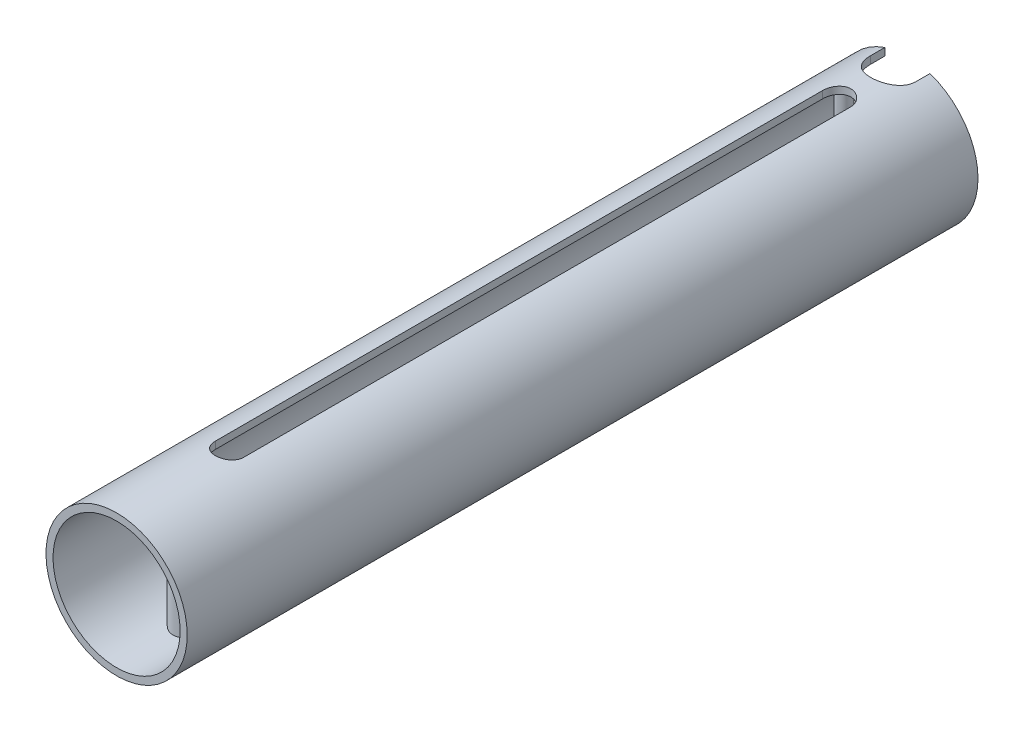
from build123d import *

# Parameters (mm, degrees)
ESQUISSE1_R                    = 5
ESQUISSE1_R_2                  = 4.5
BOSS_EXTRU_1_DEPTH             = 28
BOSS_EXTRU_2_REACH             = 30.879
ESQUISSE2_R                    = 1
ESQUISSE2_R_2                  = 0.5
BOSS_EXTRU_2_DIRECTION_2_REACH = 30.879
ENL_V_MAT_EXTRU_1_DEPTH        = 29.879058253
ENL_V_MAT_EXTRU_1_DEPTH_BACK   = 29.879058253
ENL_V_MAT_EXTRU_2_DEPTH        = 29.879058291
ENL_V_MAT_EXTRU_2_DEPTH_BACK   = 29.879058291


with BuildPart() as part:
    # Esquisse1 → Boss.-Extru.1 (new, symmetric)
    with BuildSketch(Plane.XY):
        Circle(ESQUISSE1_R)
        Circle(ESQUISSE1_R_2, mode=Mode.SUBTRACT)
    extrude(amount=BOSS_EXTRU_1_DEPTH, both=True)

    # Esquisse2 → Boss.-Extru.2 (add, up to next)
    with BuildSketch(Plane(origin=(0, 0, 0), x_dir=(1, 0, 0), z_dir=(0, 1, 0)), mode=Mode.PRIVATE) as boss_extru_2_sk1:
        with Locations((0, -23)):
            Circle(ESQUISSE2_R)
    boss_extru_2_tool1 = extrude(boss_extru_2_sk1.sketch, amount=BOSS_EXTRU_2_REACH, mode=Mode.PRIVATE) - part.part
    # Esquisse2 → Boss.-Extru.2 (add, up to next)
    with BuildSketch(Plane(origin=(0, 0, 0), x_dir=(1, 0, 0), z_dir=(0, 1, 0)), mode=Mode.PRIVATE) as boss_extru_2_sk2:
        with Locations((-3, 26.5)):
            Circle(ESQUISSE2_R_2)
    boss_extru_2_tool2 = extrude(boss_extru_2_sk2.sketch, amount=BOSS_EXTRU_2_REACH, mode=Mode.PRIVATE) - part.part
    add(boss_extru_2_tool1.solids().sort_by_distance((0, 0, 23))[0])
    add(boss_extru_2_tool2.solids().sort_by_distance((-3, 0, -26.5))[0])

    # Esquisse2 → Boss.-Extru.2 direction 2 (add, up to next)
    with BuildSketch(Plane(origin=(0, 0, 0), x_dir=(1, 0, 0), z_dir=(0, 1, 0)), mode=Mode.PRIVATE) as boss_extru_2_direction_2_sk1:
        with Locations((0, -23)):
            Circle(ESQUISSE2_R)
    boss_extru_2_direction_2_tool1 = extrude(boss_extru_2_direction_2_sk1.sketch, amount=-BOSS_EXTRU_2_DIRECTION_2_REACH, mode=Mode.PRIVATE) - part.part
    # Esquisse2 → Boss.-Extru.2 direction 2 (add, up to next)
    with BuildSketch(Plane(origin=(0, 0, 0), x_dir=(1, 0, 0), z_dir=(0, 1, 0)), mode=Mode.PRIVATE) as boss_extru_2_direction_2_sk2:
        with Locations((-3, 26.5)):
            Circle(ESQUISSE2_R_2)
    boss_extru_2_direction_2_tool2 = extrude(boss_extru_2_direction_2_sk2.sketch, amount=-BOSS_EXTRU_2_DIRECTION_2_REACH, mode=Mode.PRIVATE) - part.part
    add(boss_extru_2_direction_2_tool1.solids().sort_by_distance((0, 0, 23))[0])
    add(boss_extru_2_direction_2_tool2.solids().sort_by_distance((-3, 0, -26.5))[0])

    # Esquisse3 → Enlèv. mat.-Extru.1 (cut, two sides: drawn at the far end of the back side and taken through both)
    with BuildSketch(Plane(origin=(0, 0, 0), x_dir=(1, 0, 0), z_dir=(0, 1, 0)).offset(-ENL_V_MAT_EXTRU_1_DEPTH_BACK)):
        with BuildLine():
            Line((1, 23), (1, -20))
            ThreePointArc((1, -20), (0, -21), (-1, -20))
            Line((-1, -20), (-1, 23))
            ThreePointArc((-1, 23), (0, 24), (1, 23))
        make_face()
    extrude(amount=ENL_V_MAT_EXTRU_1_DEPTH + ENL_V_MAT_EXTRU_1_DEPTH_BACK, mode=Mode.SUBTRACT)

    # Esquisse4 → Enlèv. mat.-Extru.2 (cut, two sides: drawn at the far end of the back side and taken through both)
    with BuildSketch(Plane(origin=(0, 0, 0), x_dir=(1, 0, 0), z_dir=(0, 1, 0)).offset(-ENL_V_MAT_EXTRU_2_DEPTH_BACK)):
        with BuildLine():
            Line((-1.6, 27), (-1.6, 28))
            ThreePointArc((-1.6, 28), (0, 29.6), (1.6, 28))
            Line((1.6, 28), (1.6, 27))
            ThreePointArc((1.6, 27), (0, 25.4), (-1.6, 27))
        make_face()
    extrude(amount=ENL_V_MAT_EXTRU_2_DEPTH + ENL_V_MAT_EXTRU_2_DEPTH_BACK, mode=Mode.SUBTRACT)


solid = part.part
